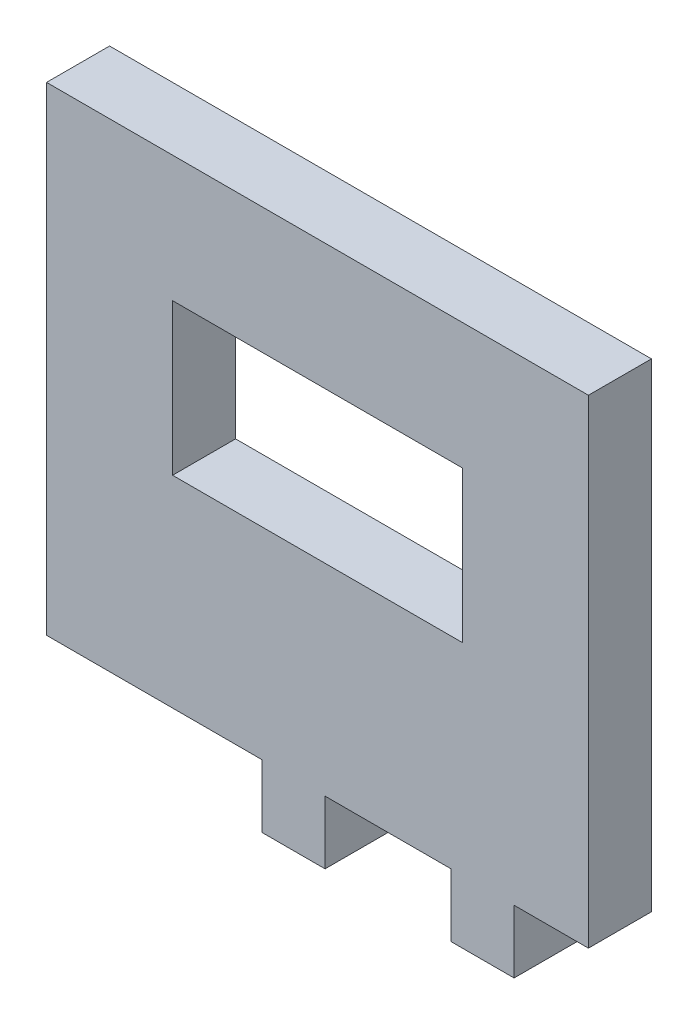
from build123d import *

# Parameters (mm, degrees)
SKETCH1_W           = 23
SKETCH1_H           = 12
BOSS_EXTRUDE2_DEPTH = 5


with BuildPart() as part:
    # Sketch1 → Boss-Extrude2 (new body)
    with BuildSketch(Plane.XY):
        Polygon((-27.1, 16), (-27.1, -22), (-10, -22), (-10, -27), (-5, -27), (-5, -22), (-1.5, -22), (1.5, -22), (5, -22), (5, -27), (10, -27), (10, -22), (15.9, -22), (15.9, 16), align=None)
        with Locations((-5.6, 0)):
            Rectangle(SKETCH1_W, SKETCH1_H, mode=Mode.SUBTRACT)
    extrude(amount=BOSS_EXTRUDE2_DEPTH)


solid = part.part
